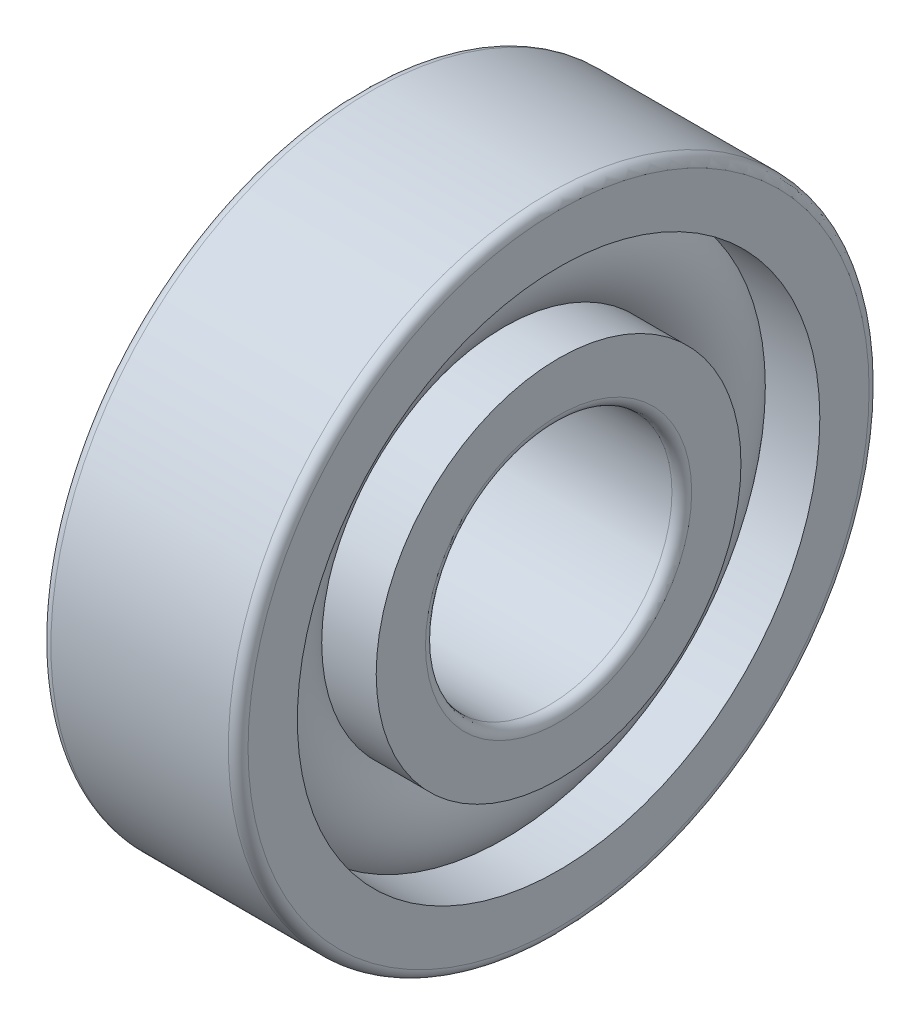
from build123d import *

# Parameters (mm, degrees)
CAGSPISKE_W     = 0.24
CAGSPISKE_H     = 0.4
CAGESPINE_ANGLE = 0.001
BALSIMSKE_R     = 1.2


with BuildPart() as part:
    # CagSpiSke → CageSpine (revolve)
    with BuildSketch(Plane.XY):
        with Locations((0, 4.5)):
            Rectangle(CAGSPISKE_W, CAGSPISKE_H)
    revolve(axis=Axis((-20.6375, 0, 0), (-1, 0, 0)), revolution_arc=CAGESPINE_ANGLE)

    # BalSimSke → BallsSimplified (revolve)
    with BuildSketch(Plane.XY):
        with Locations((0, 4.5)):
            Circle(BALSIMSKE_R)
    revolve(axis=Axis((-10, 0, 0), (1, 0, 0)))

    # InnRacSke → InnerRace (revolve)
    with BuildSketch(Plane.XY):
        with BuildLine():
            Line((-0.860595724, 3.7), (-2, 3.7))
            Line((-2, 3.7), (-2, 2.7))
            ThreePointArc((-2, 2.7), (-1.941421356, 2.558578644), (-1.8, 2.5))
            Line((-1.8, 2.5), (1.8, 2.5))
            ThreePointArc((1.8, 2.5), (1.941421356, 2.558578644), (2, 2.7))
            Line((2, 2.7), (2, 3.7))
            Line((2, 3.7), (0.860595724, 3.7))
            ThreePointArc((0.860595724, 3.7), (0, 3.325), (-0.860595724, 3.7))
        make_face()
    revolve(axis=Axis((-20.6375, 0, 0), (1, 0, 0)))

    # OutRacSke → OuterRace (revolve)
    with BuildSketch(Plane.XY):
        with BuildLine():
            Line((-0.860595724, 5.3), (-2, 5.3))
            Line((-2, 5.3), (-2, 6.3))
            ThreePointArc((-2, 6.3), (-1.941421356, 6.441421356), (-1.8, 6.5))
            Line((-1.8, 6.5), (1.8, 6.5))
            ThreePointArc((1.8, 6.5), (1.941421356, 6.441421356), (2, 6.3))
            Line((2, 6.3), (2, 5.3))
            Line((2, 5.3), (0.860595724, 5.3))
            ThreePointArc((0.860595724, 5.3), (0, 5.675), (-0.860595724, 5.3))
        make_face()
    revolve(axis=Axis((-20.6375, 0, 0), (1, 0, 0)))


solid = part.part
